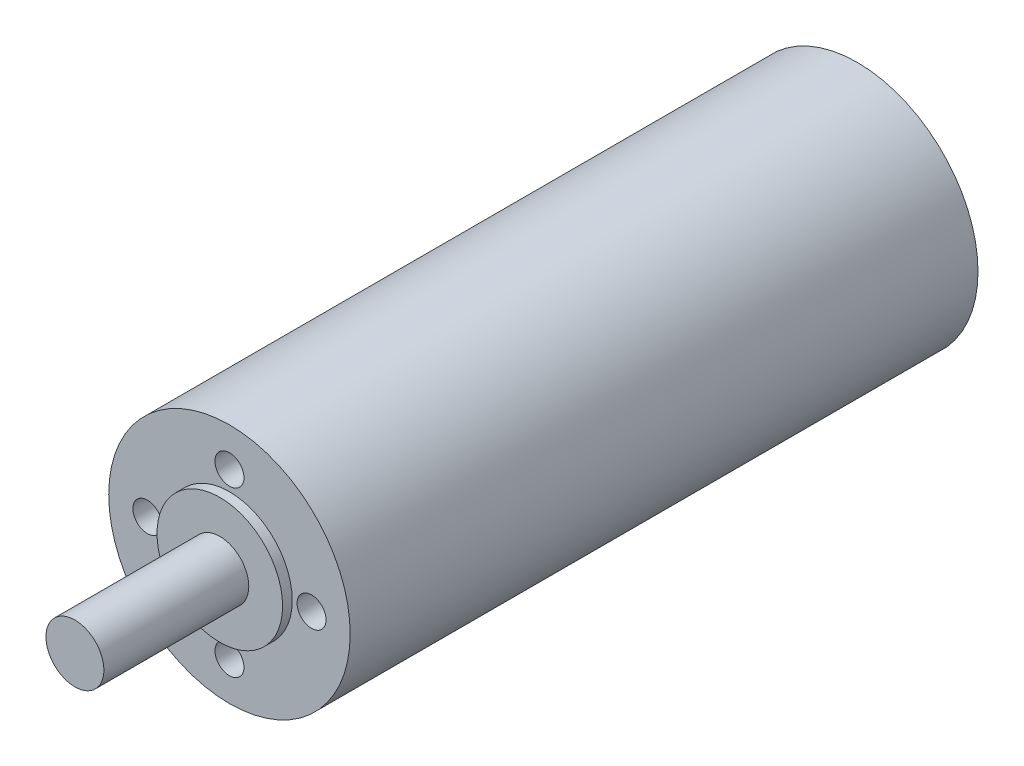
from build123d import *

# Parameters (mm, degrees)
ESBO_O1_R                = 12.5
RESSALTO_EXTRUS_O1_DEPTH = 65
ESBO_O2_R                = 6.5
RESSALTO_EXTRUS_O2_DEPTH = 1
ESBO_O3_R                = 3
RESSALTO_EXTRUS_O3_DEPTH = 15
ESBO_O4_R                = 1.5
CORTE_EXTRUS_O1_DEPTH    = 4
PADR_OCIRCULAR1_COUNT    = 4


with BuildPart() as part:
    # Esboço1 → Ressalto-extrusão1 (new body)
    with BuildSketch(Plane.XY):
        Circle(ESBO_O1_R)
    extrude(amount=RESSALTO_EXTRUS_O1_DEPTH)

    # Esboço2 → Ressalto-extrusão2 (add)
    with BuildSketch(Plane.XY.offset(65)):
        Circle(ESBO_O2_R)
    extrude(amount=RESSALTO_EXTRUS_O2_DEPTH)

    # Esboço3 → Ressalto-extrusão3 (add)
    with BuildSketch(Plane.XY.offset(66)):
        Circle(ESBO_O3_R)
    extrude(amount=RESSALTO_EXTRUS_O3_DEPTH)

    # Esboço4 → Corte-extrusão1 (cut)
    with BuildSketch(Plane.XY.offset(65)):
        with Locations((0, -8.5)):
            Circle(ESBO_O4_R)
    corte_extrus_o1 = extrude(amount=-CORTE_EXTRUS_O1_DEPTH, mode=Mode.SUBTRACT)

    # PadrãoCircular1: Corte-extrusão1 ×4 about axis
    padr_ocircular1_axis = Axis((0, 0, 81), (0, 0, -1))
    for i in range(1, PADR_OCIRCULAR1_COUNT):
        add(corte_extrus_o1.rotate(padr_ocircular1_axis, i * 360 / PADR_OCIRCULAR1_COUNT), mode=Mode.SUBTRACT)


solid = part.part
